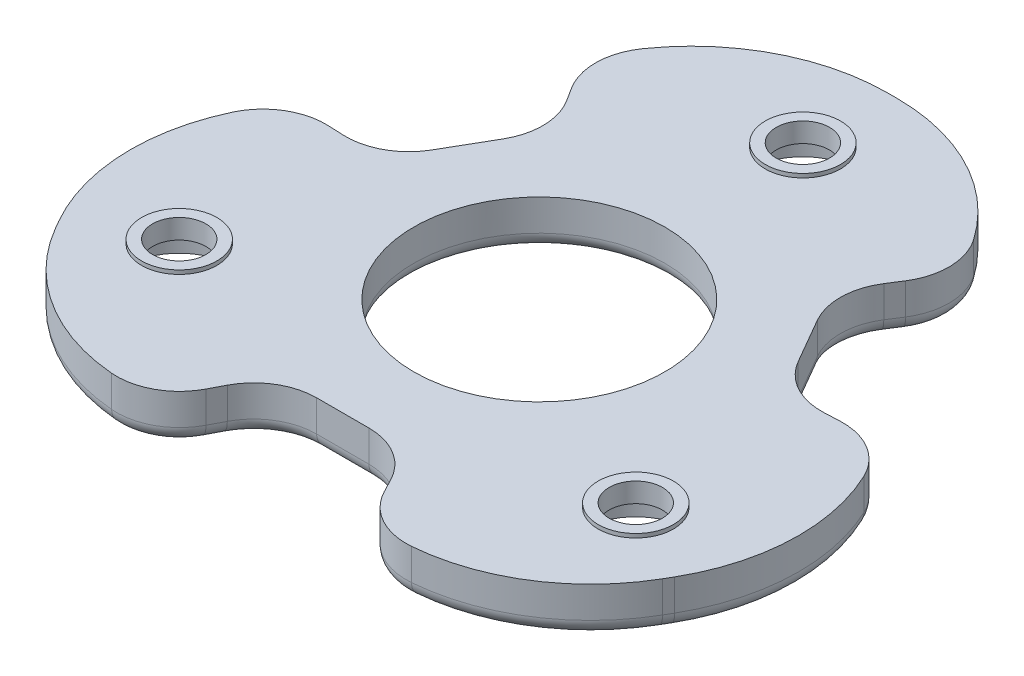
from build123d import *

# Parameters (mm, degrees)
SKETCH2_R           = 1.7
SKETCH2_R_2         = 8
BOSS_EXTRUDE1_DEPTH = 1
BOSS_EXTRUDE2_START = 2
SKETCH3_R           = 3.5
SKETCH3_R_2         = 8
BOSS_EXTRUDE2_DEPTH = 2
FILLET1_R           = 4
FILLET2_R           = 1
SKETCH4_R           = 2.4
SKETCH4_R_2         = 1.7
BOSS_EXTRUDE3_DEPTH = 0.25


with BuildPart() as part:
    # Sketch2 → Boss-Extrude1 (new body)
    with BuildSketch(Plane(origin=(0, 0, 0), x_dir=(1, 0, 0), z_dir=(0, 1, 0))):
        with BuildLine():
            Line((-0.283121635, 22.5), (0.283121635, 22.5))
            ThreePointArc((0.283121635, 22.5), (6.533121635, 20.825317547), (11.108439182, 16.25))
            Line((11.108439182, 16.25), (11.96100502, 14.773312653))
            Line((11.96100502, 14.773312653), (8.801814855, 9.805210306))
            Line((8.801814855, 9.805210306), (12.892468642, 2.719990111))
            Line((12.892468642, 2.719990111), (18.774566565, 2.971877876))
            Line((18.774566565, 2.971877876), (19.627132398, 1.495190536))
            ThreePointArc((19.627132398, 1.495190536), (21.301814851, -4.754809288), (19.627132574, -11.004809159))
            Line((19.627132574, -11.004809159), (19.344010953, -11.495190224))
            ThreePointArc((19.344010953, -11.495190224), (14.768693382, -16.070507988), (8.518693229, -17.745190528))
            Line((8.518693229, -17.745190528), (6.813561546, -17.745190528))
            Line((6.813561546, -17.745190528), (4.090653786, -12.525200417))
            Line((4.090653786, -12.525200417), (-4.090653786, -12.525200417))
            Line((-4.090653786, -12.525200417), (-6.813561546, -17.745190528))
            Line((-6.813561546, -17.745190528), (-8.51869322, -17.745190528))
            ThreePointArc((-8.51869322, -17.745190528), (-14.76869322, -16.070508076), (-19.344010768, -11.495190528))
            Line((-19.344010768, -11.495190528), (-19.627132403, -11.004809472))
            ThreePointArc((-19.627132403, -11.004809472), (-21.301814855, -4.754809472), (-19.627132403, 1.495190528))
            Line((-19.627132403, 1.495190528), (-18.774566565, 2.971877876))
            Line((-18.774566565, 2.971877876), (-12.892468642, 2.719990111))
            Line((-12.892468642, 2.719990111), (-8.801814855, 9.805210306))
            Line((-8.801814855, 9.805210306), (-11.96100502, 14.773312653))
            Line((-11.96100502, 14.773312653), (-11.108439182, 16.25))
            ThreePointArc((-11.108439182, 16.25), (-6.533121635, 20.825317547), (-0.283121635, 22.5))
        make_face()
        with Locations((0, 16.8)):
            Circle(SKETCH2_R, mode=Mode.SUBTRACT)
        with Locations((14.549226784, -8.4)):
            Circle(SKETCH2_R, mode=Mode.SUBTRACT)
        with Locations((-14.549226784, -8.4)):
            Circle(SKETCH2_R, mode=Mode.SUBTRACT)
        Circle(SKETCH2_R_2, mode=Mode.SUBTRACT)
    extrude(amount=BOSS_EXTRUDE1_DEPTH)

    # Sketch3 → Boss-Extrude2 (add)
    with BuildSketch(Plane.XZ.offset(BOSS_EXTRUDE2_START)):
        with BuildLine():
            Line((19.627132574, 11.004809159), (19.344010953, 11.495190224))
            ThreePointArc((19.344010953, 11.495190224), (14.768693382, 16.070507988), (8.518693229, 17.745190528))
            Line((8.518693229, 17.745190528), (6.813561546, 17.745190528))
            Line((6.813561546, 17.745190528), (4.090653786, 12.525200417))
            Line((4.090653786, 12.525200417), (-4.090653786, 12.525200417))
            Line((-4.090653786, 12.525200417), (-6.813561546, 17.745190528))
            Line((-6.813561546, 17.745190528), (-8.51869322, 17.745190528))
            ThreePointArc((-8.51869322, 17.745190528), (-14.76869322, 16.070508076), (-19.344010768, 11.495190528))
            Line((-19.344010768, 11.495190528), (-19.627132403, 11.004809472))
            ThreePointArc((-19.627132403, 11.004809472), (-21.301814855, 4.754809472), (-19.627132403, -1.495190528))
            Line((-19.627132403, -1.495190528), (-18.774566565, -2.971877876))
            Line((-18.774566565, -2.971877876), (-12.892468642, -2.719990111))
            Line((-12.892468642, -2.719990111), (-8.801814855, -9.805210306))
            Line((-8.801814855, -9.805210306), (-11.96100502, -14.773312653))
            Line((-11.96100502, -14.773312653), (-11.108439182, -16.25))
            ThreePointArc((-11.108439182, -16.25), (-6.533121635, -20.825317547), (-0.283121635, -22.5))
            Line((-0.283121635, -22.5), (0.283121635, -22.5))
            ThreePointArc((0.283121635, -22.5), (6.533121635, -20.825317547), (11.108439182, -16.25))
            Line((11.108439182, -16.25), (11.96100502, -14.773312653))
            Line((11.96100502, -14.773312653), (8.801814855, -9.805210306))
            Line((8.801814855, -9.805210306), (12.892468642, -2.719990111))
            Line((12.892468642, -2.719990111), (18.774566565, -2.971877876))
            Line((18.774566565, -2.971877876), (19.627132398, -1.495190536))
            ThreePointArc((19.627132398, -1.495190536), (21.301814851, 4.754809288), (19.627132574, 11.004809159))
        make_face()
        with Locations((-14.549226784, 8.4)):
            Circle(SKETCH3_R, mode=Mode.SUBTRACT)
        with Locations((0, -16.8)):
            Circle(SKETCH3_R, mode=Mode.SUBTRACT)
        with Locations((14.549226784, 8.4)):
            Circle(SKETCH3_R, mode=Mode.SUBTRACT)
        Circle(SKETCH3_R_2, mode=Mode.SUBTRACT)
    extrude(amount=-BOSS_EXTRUDE2_DEPTH)

    # Fillet1
    fillet1_edges = [part.edges().sort_by_distance(p)[0] for p in [
        (-11.96100502, -0.5, -14.773312653),
        (-8.801814855, -0.5, -9.805210306),
        (-18.774566565, -0.5, -2.971877876),
        (-12.892468642, -0.5, -2.719990111),
        (-6.813561546, -0.5, 17.745190528),
        (-4.090653786, -0.5, 12.525200417),
        (6.813561546, -0.5, 17.745190528),
        (4.090653786, -0.5, 12.525200417),
        (18.774566565, -0.5, -2.971877876),
        (12.892468642, -0.5, -2.719990111),
        (8.801814855, -0.5, -9.805210306),
        (11.96100502, -0.5, -14.773312653),
    ]]
    fillet(fillet1_edges, radius=FILLET1_R)

    # Fillet2
    fillet2_edges = [part.edges().sort_by_distance(p)[0] for p in [
        (18.559190998, -2, -2.293594488),
        (15.817036262, -2, -2.845228217),
        (13.218662983, -2, -3.313974545),
        (10.847141749, -2, -6.262600208),
        (9.479317635, -2, -9.790710675),
        (10.372558046, -2, -12.275341107),
        (11.265906592, -2, -14.925933632),
        (6.078690535, -2, -21.075259867),
        (0, -2, -22.5),
        (-6.078690535, -2, -21.075259867),
        (-11.265906592, -2, -14.925933632),
        (-10.372558046, -2, -12.275341107),
        (-9.479317635, -2, -9.790710675),
        (-10.847141749, -2, -6.262600208),
        (-13.218662983, -2, -3.313974545),
        (-15.817036262, -2, -2.845228217),
        (-18.559190997, -2, -2.293594489),
        (-21.291055704, -2, 5.273329508),
        (-19.485571585, -2, 11.25),
        (-15.212365169, -2, 15.801930359),
        (-7.293284405, -2, 17.219528121),
        (-5.444478216, -2, 15.120569324),
        (-3.739345348, -2, 13.10468522),
        (0, -2, 12.525200417),
        (3.739345348, -2, 13.10468522),
        (5.444478216, -2, 15.120569324),
        (7.293284403, -2, 17.219528121),
        (15.212365321, -2, 15.801930268),
        (19.485571763, -2, 11.249999692),
        (-8, -2, 0),
        (21.291055706, -2, 5.273329331),
    ]]
    fillet(fillet2_edges, radius=FILLET2_R)

    # Sketch4 → Boss-Extrude3 (add, symmetric)
    # profile 1 of 3: a face of its own
    with BuildSketch(Plane(origin=(0, 1, 0), x_dir=(1, 0, 0), z_dir=(0, 1, 0))):
        with Locations((0, 16.8)):
            Circle(SKETCH4_R)
        with Locations((0, 16.8)):
            Circle(SKETCH4_R_2, mode=Mode.SUBTRACT)
    # profile 2 of 3: a face of its own
    with BuildSketch(Plane(origin=(0, 1, 0), x_dir=(1, 0, 0), z_dir=(0, 1, 0))):
        with Locations((14.549226784, -8.4)):
            Circle(SKETCH4_R)
        with Locations((14.549226784, -8.4)):
            Circle(SKETCH4_R_2, mode=Mode.SUBTRACT)
    # profile 3 of 3: a face of its own
    with BuildSketch(Plane(origin=(0, 1, 0), x_dir=(1, 0, 0), z_dir=(0, 1, 0))):
        with Locations((-14.549226784, -8.4)):
            Circle(SKETCH4_R)
        with Locations((-14.549226784, -8.4)):
            Circle(SKETCH4_R_2, mode=Mode.SUBTRACT)
    extrude(amount=BOSS_EXTRUDE3_DEPTH, both=True)


solid = part.part
